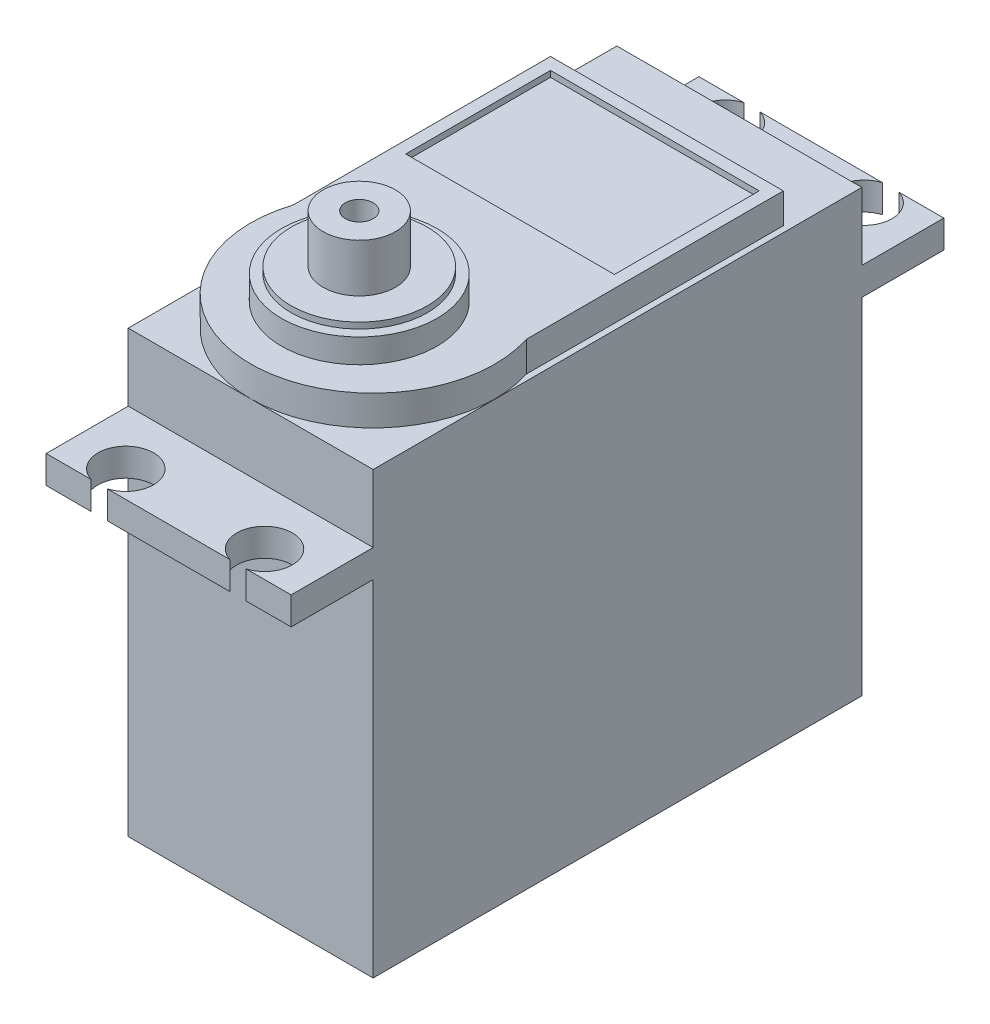
from build123d import *

# Parameters (mm, degrees)
SKETCH1_W           = 20.3
SKETCH1_H           = 40.5
BOSS_EXTRUDE1_DEPTH = 36.5
SKETCH4_W           = 20.3
SKETCH4_H           = 2.3
BOSS_EXTRUDE4_DEPTH = 6.8
CUT_EXTRUDE1_REACH  = 44.303
BOSS_EXTRUDE5_DEPTH = 2.5
SKETCH10_R          = 6.45
BOSS_EXTRUDE6_DEPTH = 2
SKETCH11_R          = 5.65
BOSS_EXTRUDE7_DEPTH = 0.5
SKETCH12_R          = 3
BOSS_EXTRUDE8_DEPTH = 4
SKETCH13_R          = 1.15
CUT_EXTRUDE2_DEPTH  = 4
SKETCH14_W          = 17.3
SKETCH14_H          = 12
CUT_EXTRUDE3_DEPTH  = 0.5


with BuildPart() as part:
    # Sketch1 → Boss-Extrude1 (new body)
    with BuildSketch(Plane(origin=(0, 0, 0), x_dir=(1, 0, 0), z_dir=(0, 1, 0))):
        Rectangle(SKETCH1_W, SKETCH1_H)
    extrude(amount=BOSS_EXTRUDE1_DEPTH)

    # Sketch4 → Boss-Extrude4 (add)
    with BuildSketch(Plane.XY.offset(20.25)):
        with Locations((0, 29.75)):
            Rectangle(SKETCH4_W, SKETCH4_H)
    boss_extrude4 = extrude(amount=BOSS_EXTRUDE4_DEPTH)

    # Sketch5 → Cut-Extrude1 (cut, up to next)
    with BuildSketch(Plane(origin=(0, 30.9, 0), x_dir=(1, 0, 0), z_dir=(0, 1, 0)), mode=Mode.PRIVATE) as cut_extrude1_sk1:
        with BuildLine():
            Line((-6.420820393, -27.05), (-5.079179607, -27.05))
            ThreePointArc((-5.079179607, -27.05), (-5.75, -22.55), (-6.420820393, -27.05))
        make_face()
    cut_extrude1_tool1 = extrude(cut_extrude1_sk1.sketch, amount=-CUT_EXTRUDE1_REACH, mode=Mode.PRIVATE) & part.part
    # Sketch5 → Cut-Extrude1 (cut, up to next)
    with BuildSketch(Plane(origin=(0, 30.9, 0), x_dir=(1, 0, 0), z_dir=(0, 1, 0)), mode=Mode.PRIVATE) as cut_extrude1_sk2:
        with BuildLine():
            Line((5.75, -27.05), (6.420820393, -27.05))
            ThreePointArc((6.420820393, -27.05), (5.75, -22.55), (5.079179607, -27.05))
            Line((5.079179607, -27.05), (5.75, -27.05))
        make_face()
    cut_extrude1_tool2 = extrude(cut_extrude1_sk2.sketch, amount=-CUT_EXTRUDE1_REACH, mode=Mode.PRIVATE) & part.part
    cut_extrude1_1 = cut_extrude1_tool1.solids().sort_by_distance((-5.75, 30.9, 24.837825))[0]
    add(cut_extrude1_1, mode=Mode.SUBTRACT)
    cut_extrude1_2 = cut_extrude1_tool2.solids().sort_by_distance((5.75, 30.9, 24.837825))[0]
    add(cut_extrude1_2, mode=Mode.SUBTRACT)
    cut_extrude1 = cut_extrude1_1 + cut_extrude1_2  # Cut-Extrude1 as one shape, for the pattern or mirror that repeats it

    # Mirror2: Boss-Extrude4, Cut-Extrude1 across plane
    add(boss_extrude4.mirror(Plane.XY))
    add(cut_extrude1.mirror(Plane.XY), mode=Mode.SUBTRACT)

    # Sketch7 → Boss-Extrude5 (add)
    with BuildSketch(Plane(origin=(0, 36.5, 0), x_dir=(1, 0, 0), z_dir=(0, 1, 0))):
        with BuildLine():
            Line((-9.65, 14.25), (-9.65, -7.05))
            ThreePointArc((-9.65, -7.05), (0, -20.25), (9.65, -7.05))
            Line((9.65, -7.05), (9.65, 14.25))
            Line((9.65, 14.25), (-9.65, 14.25))
        make_face()
    extrude(amount=BOSS_EXTRUDE5_DEPTH)

    # Sketch10 → Boss-Extrude6 (add)
    with BuildSketch(Plane(origin=(0, 39, 0), x_dir=(1, 0, 0), z_dir=(0, 1, 0))):
        with Locations((0, -11.25)):
            Circle(SKETCH10_R)
    extrude(amount=BOSS_EXTRUDE6_DEPTH)

    # Sketch11 → Boss-Extrude7 (add)
    with BuildSketch(Plane(origin=(0, 41, 0), x_dir=(1, 0, 0), z_dir=(0, 1, 0))):
        with Locations((0, -11.25)):
            Circle(SKETCH11_R)
    extrude(amount=BOSS_EXTRUDE7_DEPTH)

    # Sketch12 → Boss-Extrude8 (add)
    with BuildSketch(Plane(origin=(0, 41.5, 0), x_dir=(1, 0, 0), z_dir=(0, 1, 0))):
        with Locations((0, -11.25)):
            Circle(SKETCH12_R)
    extrude(amount=BOSS_EXTRUDE8_DEPTH)

    # Sketch13 → Cut-Extrude2 (cut)
    with BuildSketch(Plane(origin=(0, 45.5, 0), x_dir=(1, 0, 0), z_dir=(0, 1, 0))):
        with Locations((0, -11.25)):
            Circle(SKETCH13_R)
    extrude(amount=-CUT_EXTRUDE2_DEPTH, mode=Mode.SUBTRACT)

    # Sketch14 → Cut-Extrude3 (cut)
    with BuildSketch(Plane(origin=(0, 39, 0), x_dir=(1, 0, 0), z_dir=(0, 1, 0))):
        with Locations((0, 7.25)):
            Rectangle(SKETCH14_W, SKETCH14_H)
    extrude(amount=-CUT_EXTRUDE3_DEPTH, mode=Mode.SUBTRACT)


solid = part.part
